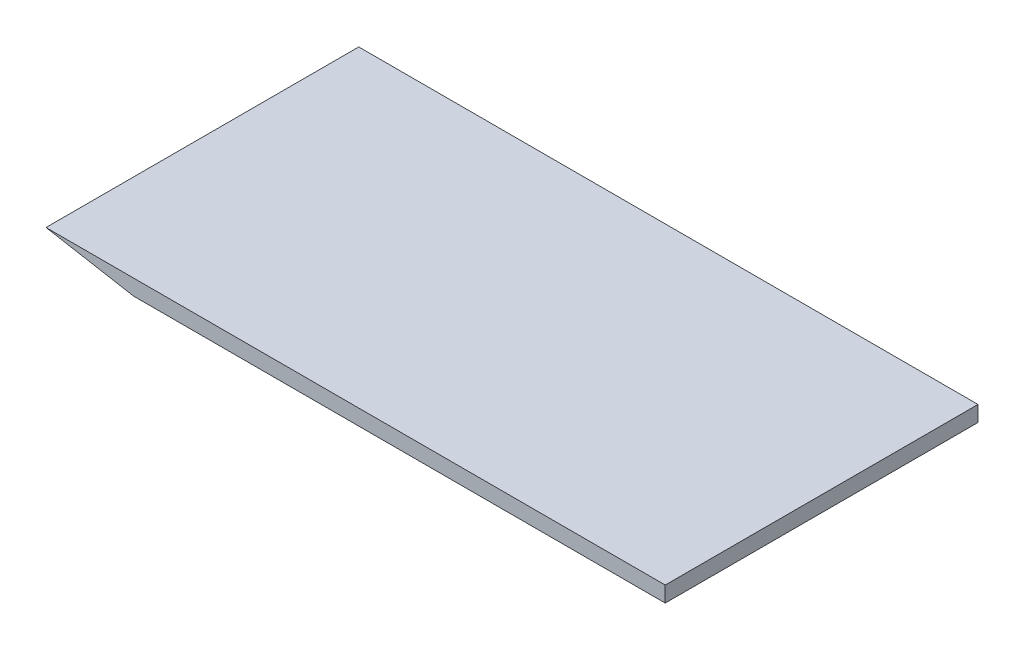
from build123d import *

# Parameters (mm, degrees)
BOSS_EXTRUDE1_DEPTH = 100


with BuildPart() as part:
    # Sketch1 → Boss-Extrude1 (new body)
    with BuildSketch(Plane.XY):
        Polygon((0, 0), (198, 0), (198, -5), (28, -5), align=None)
    extrude(amount=BOSS_EXTRUDE1_DEPTH)


solid = part.part
